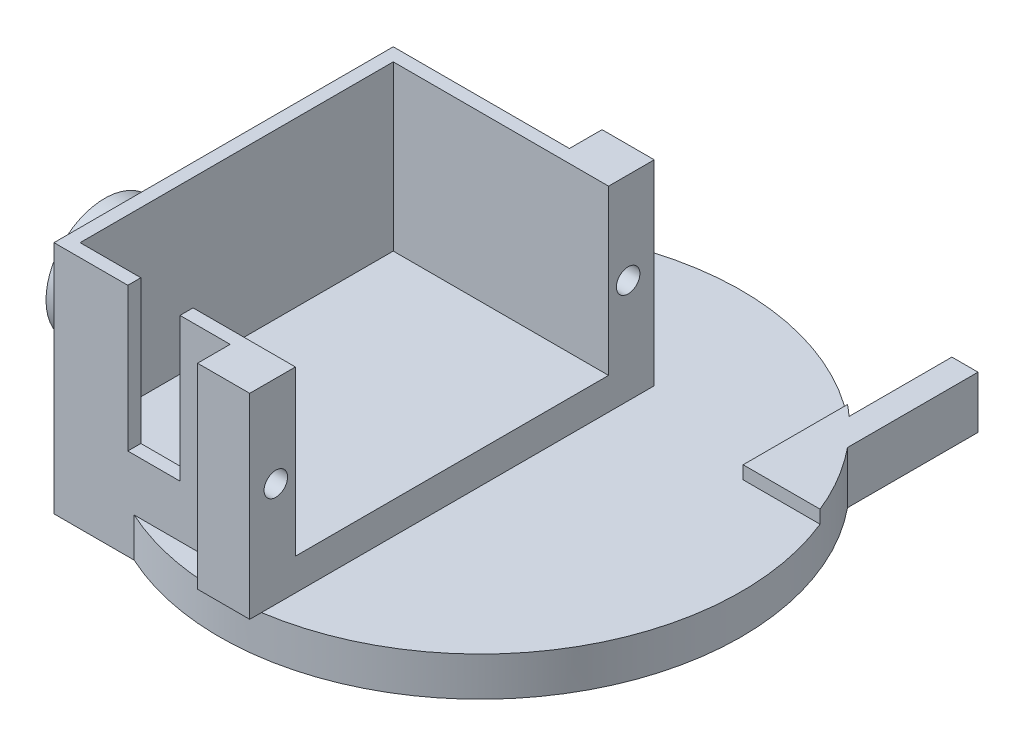
from build123d import *

# Parameters (mm, degrees)
P_IDAT_VYSUNUT_M1_DEPTH   = 15
ZAOBLIT1_R                = 7.5
SKICA6_R                  = 3.75
ODEBRAT_VYSUNUT_M4_DEPTH  = 5
SKICA7_R                  = 4.75
ODEBRAT_VYSUNUT_M5_DEPTH  = 5
P_IDAT_VYSUNUT_M2_DEPTH   = 15
SKICA10_W                 = 16.5
SKICA10_H                 = 24
ODEBRAT_VYSUNUT_M7_DEPTH  = 14
SKICA11_W                 = 2.5
SKICA11_H                 = 15
P_IDAT_VYSUNUT_M3_DEPTH   = 4
SKICA12_R                 = 0.9
ODEBRAT_VYSUNUT_M8_DEPTH  = 4
SKICA13_W                 = 4
SKICA13_H                 = 11
ODEBRAT_VYSUNUT_M9_DEPTH  = 4
SKICA15_W                 = 30.75
SKICA15_H                 = 32.5
ODEBRAT_VYSUNUT_M10_DEPTH = 30
SKICA16_R                 = 20
P_IDAT_VYSUNUT_M4_DEPTH   = 3
SKICA17_W                 = 1
SKICA17_H                 = 28
ODEBRAT_VYSUNUT_M11_DEPTH = 15
SKICA18_R                 = 6
P_IDAT_VYSUNUT_M5_DEPTH   = 0.5
SKICA19_R                 = 4.5
P_IDAT_VYSUNUT_M6_DEPTH   = 3
SKICA20_W                 = 16.5
SKICA20_H                 = 24
P_IDAT_VYSUNUT_M7_DEPTH   = 1.44
P_IDAT_VYSUNUT_M8_DEPTH   = 3
P_IDAT_START              = 1
P_IDAT_VYSUNUT_M9_DEPTH   = 1
P_IDAT_VYSUNUT_M10_DEPTH  = 3
SKICA24_R                 = 1
ODEBRAT_VYSUNUT_M12_DEPTH = 0.5
ODEBRAT_VYSUNUT_M14_DEPTH = 0.5


with BuildPart() as part:
    # Skica1 → Přidat vysunutím1 (new body)
    with BuildSketch(Plane(origin=(0, 0, 0), x_dir=(1, 0, 0), z_dir=(0, 1, 0))):
        Polygon((0, -11), (0, 11), (-3.25, 14.25), (-30.25, 14.25), (-30.25, 16.25), (-2.421572875, 16.25), (1, 12.828427125), (1, -12.828427125), (-2.421572875, -16.25), (-30.25, -16.25), (-30.25, -14.25), (-3.25, -14.25), align=None)
    extrude(amount=P_IDAT_VYSUNUT_M1_DEPTH)

    # Zaoblit1
    zaoblit1_edges = [part.edges().sort_by_distance(p)[0] for p in [
        (-30.25, 0, -15.25),
        (-30.25, 0, 15.25),
        (-30.25, 15, 15.25),
        (-30.25, 15, -15.25),
    ]]
    fillet(zaoblit1_edges, radius=ZAOBLIT1_R - 0.0001)  # a hair under: the kernel refuses the full size

    # Skica6 → Odebrat vysunutím4 (cut)
    with BuildSketch(Plane(origin=(0, 0, -16.25), x_dir=(-1, 0, 0), z_dir=(0, 0, -1))):
        with Locations((22.75, 7.5)):
            Circle(SKICA6_R)
    extrude(amount=-ODEBRAT_VYSUNUT_M4_DEPTH, mode=Mode.SUBTRACT)

    # Skica7 → Odebrat vysunutím5 (cut)
    with BuildSketch(Plane(origin=(0, 0, 14.25), x_dir=(-1, 0, 0), z_dir=(0, 0, -1))):
        with Locations((22.75, 7.5)):
            Circle(SKICA7_R)
    extrude(amount=-ODEBRAT_VYSUNUT_M5_DEPTH, mode=Mode.SUBTRACT)

    # Skica8 → Přidat vysunutím2 (add)
    with BuildSketch(Plane.XZ):
        Polygon((0.656854249, 13.171572875), (19, 13.171572875), (19, -12.828427125), (1, -12.828427125), (1, 12.828427125), align=None)
    extrude(amount=-P_IDAT_VYSUNUT_M2_DEPTH)

    # Skica10 → Odebrat vysunutím7 (cut)
    with BuildSketch(Plane(origin=(0, 15, 0), x_dir=(1, 0, 0), z_dir=(0, 1, 0))):
        with Locations((10.75, -0.171572875)):
            Rectangle(SKICA10_W, SKICA10_H)
    extrude(amount=-ODEBRAT_VYSUNUT_M7_DEPTH, mode=Mode.SUBTRACT)

    # Skica11 → Přidat vysunutím3 (add)
    with BuildSketch(Plane(origin=(19, 0, 0), x_dir=(0, 0, -1), z_dir=(1, 0, 0))):
        with Locations((-14.421572875, 7.5)):
            Rectangle(SKICA11_W, SKICA11_H)
        with Locations((14.078427125, 7.5)):
            Rectangle(SKICA11_W, SKICA11_H)
    extrude(amount=-P_IDAT_VYSUNUT_M3_DEPTH)

    # Skica12 → Odebrat vysunutím8 (cut)
    with BuildSketch(Plane(origin=(19, 0, 0), x_dir=(0, 0, -1), z_dir=(1, 0, 0))):
        with Locations((-13.671572875, 8)):
            Circle(SKICA12_R)
        with Locations((13.328427125, 8)):
            Circle(SKICA12_R)
    extrude(amount=-ODEBRAT_VYSUNUT_M8_DEPTH, mode=Mode.SUBTRACT)

    # Skica13 → Odebrat vysunutím9 (cut)
    with BuildSketch(Plane.XY.offset(13.171572875)):
        with Locations((9.156854249, 9.5)):
            Rectangle(SKICA13_W, SKICA13_H)
    extrude(amount=-ODEBRAT_VYSUNUT_M9_DEPTH, mode=Mode.SUBTRACT)

    # Skica15 → Odebrat vysunutím10 (cut)
    with BuildSketch(Plane(origin=(0, 15, 0), x_dir=(1, 0, 0), z_dir=(0, 1, 0))):
        with Locations((-14.875, 0)):
            Rectangle(SKICA15_W, SKICA15_H)
    extrude(amount=-ODEBRAT_VYSUNUT_M10_DEPTH, mode=Mode.SUBTRACT)

    # Skica16 → Přidat vysunutím4 (add)
    with BuildSketch(Plane.XZ):
        with Locations(Location((16, -5, 0), (0, 0, 92.865983983))):
            Circle(SKICA16_R)
    extrude(amount=P_IDAT_VYSUNUT_M4_DEPTH)

    # Skica17 → Odebrat vysunutím11 (cut)
    with BuildSketch(Plane(origin=(0, 15, 0), x_dir=(1, 0, 0), z_dir=(0, 1, 0))):
        with Locations((1, -0.671572875)):
            Rectangle(SKICA17_W, SKICA17_H)
    extrude(amount=-ODEBRAT_VYSUNUT_M11_DEPTH, mode=Mode.SUBTRACT)

    # Skica18 → Přidat vysunutím5 (add)
    with BuildSketch(Plane.ZY.offset(-1.5)):
        with Locations(Location((5.784090316, 7.999938585, 0), (0, 0, 180))):
            Circle(SKICA18_R)
    extrude(amount=P_IDAT_VYSUNUT_M5_DEPTH)

    # Skica19 → Přidat vysunutím6 (add)
    with BuildSketch(Plane.ZY.offset(-1)):
        with Locations((5.784090316, 7.999938585)):
            Circle(SKICA19_R)
    extrude(amount=P_IDAT_VYSUNUT_M6_DEPTH)

    # Skica20 → Přidat vysunutím7 (add)
    with BuildSketch(Plane(origin=(0, 1, 0), x_dir=(1, 0, 0), z_dir=(0, 1, 0))):
        with Locations((10.75, -0.171572875)):
            Rectangle(SKICA20_W, SKICA20_H)
    extrude(amount=P_IDAT_VYSUNUT_M7_DEPTH)

    # Skica21 → Přidat vysunutím8 (add)
    with BuildSketch(Plane(origin=(0, 0, 0), x_dir=(1, 0, 0), z_dir=(0, 1, 0))):
        with BuildLine():
            Line((29.5, 27.63922466), (31.5, 27.63922466))
            Line((31.5, 27.63922466), (31.5, 17.63922466))
            ThreePointArc((31.5, 17.63922466), (30.538588644, 18.734243344), (29.5, 19.756354563))
            Line((29.5, 19.756354563), (29.5, 27.63922466))
        make_face()
    extrude(amount=-P_IDAT_VYSUNUT_M8_DEPTH)

    # Skica22 → Přidat vysunutím9 (add)
    with BuildSketch(Plane(origin=(0, 0, 0), x_dir=(1, 0, 0), z_dir=(0, 1, 0)).offset(P_IDAT_START)):
        with BuildLine():
            Line((29.5, 27.63922466), (31.5, 27.63922466))
            Line((31.5, 27.63922466), (31.5, 17.63922466))
            ThreePointArc((31.5, 17.63922466), (33.214733837, 15.181008738), (34.542861865, 12.494149308))
            Line((34.542861865, 12.494149308), (28.646396214, 12.494149308))
            Line((28.646396214, 12.494149308), (28.646396214, 20.494149308))
            ThreePointArc((28.646396214, 20.494149308), (29.078401814, 20.131272451), (29.5, 19.756354563))
            Line((29.5, 19.756354563), (29.5, 27.63922466))
        make_face()
    extrude(amount=-P_IDAT_VYSUNUT_M9_DEPTH)

    # Skica23 → Přidat vysunutím10 (add)
    with BuildSketch(Plane.XZ):
        with BuildLine():
            Line((1.5, 8.774977314), (1.5, 13.171572875))
            Line((1.5, 13.171572875), (7.645723296, 13.171572875))
            ThreePointArc((7.645723296, 13.171572875), (4.363333637, 11.26616107), (1.5, 8.774977314))
        make_face()
    extrude(amount=P_IDAT_VYSUNUT_M10_DEPTH)

    # Skica24 → Odebrat vysunutím12 (cut)
    with BuildSketch(Plane.XZ.offset(3)):
        with Locations(Location((16, -5, 0), (0, 0, 270))):
            Circle(SKICA24_R)
    extrude(amount=-ODEBRAT_VYSUNUT_M12_DEPTH, mode=Mode.SUBTRACT)

    # Skica25 → Odebrat vysunutím14 (cut)
    with BuildSketch(Plane.XZ.offset(3)):
        Polygon((15, 7.5), (15, -4), (16, -4), (17, -4), (17, 7.5), align=None)
        Polygon((3.5, -6), (15, -6), (15, -5.000000001), (15, -4), (3.5, -4), align=None)
        Polygon((17, -5), (17, -6), (28.5, -6), (28.5, -4), (17, -4), align=None)
        Polygon((15, -6), (15, -17.5), (17, -17.5), (17, -6), (16, -6), align=None)
        with BuildLine():
            Line((15, -4), (15, -5.000000001))
            ThreePointArc((15, -5.000000001), (15.292893218, -4.292893219), (16, -4))
            Line((16, -4), (15, -4))
        make_face()
        with BuildLine():
            ThreePointArc((16, -4), (16.707106781, -4.292893219), (17, -5))
            Line((17, -5), (17, -4))
            Line((17, -4), (16, -4))
        make_face()
        with BuildLine():
            Line((16, -6), (17, -6))
            Line((17, -6), (17, -5))
            ThreePointArc((17, -5), (16.707106781, -5.707106781), (16, -6))
        make_face()
        with BuildLine():
            Line((15, -5.000000001), (15, -6))
            Line((15, -6), (16, -6))
            ThreePointArc((16, -6), (15.292893219, -5.707106782), (15, -5.000000001))
        make_face()
    extrude(amount=-ODEBRAT_VYSUNUT_M14_DEPTH, mode=Mode.SUBTRACT)


solid = part.part
